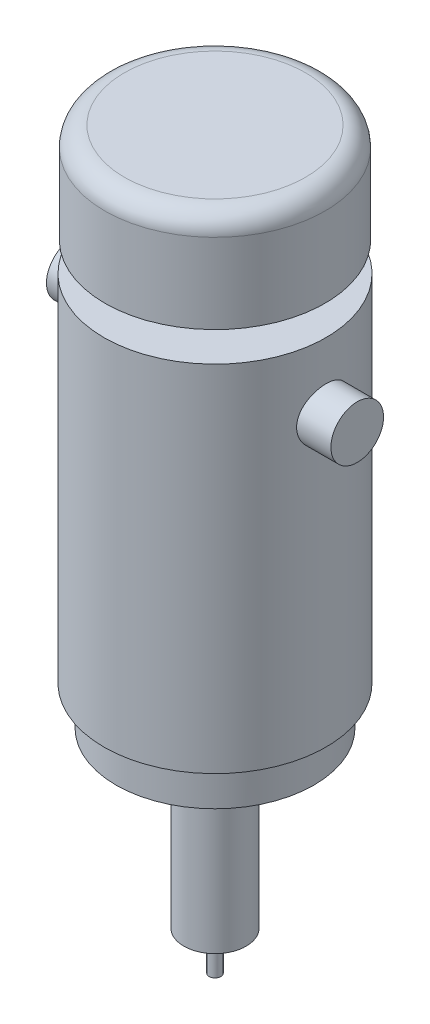
from build123d import *

# Parameters (mm, degrees)
SKETCH1_R           = 28.5
BOSS_EXTRUDE1_DEPTH = 45.5
SKETCH4_R           = 25.4
BOSS_EXTRUDE4_DEPTH = 10
SKETCH5_R           = 12.65
BOSS_EXTRUDE5_DEPTH = 2.5
SKETCH2_R           = 8
BOSS_EXTRUDE2_DEPTH = 42
SKETCH6_R           = 4
BOSS_EXTRUDE6_DEPTH = 33
SKETCH7_R           = 28.25
BOSS_EXTRUDE7_DEPTH = 25.5
FILLET1_R           = 5
SKETCH3_R           = 1.5
BOSS_EXTRUDE3_DEPTH = 10
SKETCH8_R           = 6.75
BOSS_EXTRUDE8_DEPTH = 36.5


with BuildPart() as part:
    # Sketch1 → Boss-Extrude1 (new, symmetric)
    with BuildSketch(Plane(origin=(0, 0, 0), x_dir=(1, 0, 0), z_dir=(0, 1, 0))):
        Circle(SKETCH1_R)
    extrude(amount=BOSS_EXTRUDE1_DEPTH, both=True)

    # Sketch4 → Boss-Extrude4 (add)
    with BuildSketch(Plane.XZ.offset(45.5)):
        Circle(SKETCH4_R)
    extrude(amount=BOSS_EXTRUDE4_DEPTH)

    # Sketch5 → Boss-Extrude5 (add)
    with BuildSketch(Plane.XZ.offset(55.5)):
        Circle(SKETCH5_R)
    extrude(amount=BOSS_EXTRUDE5_DEPTH)

    # Sketch2 → Boss-Extrude2 (add)
    with BuildSketch(Plane.XZ.offset(58)):
        Circle(SKETCH2_R)
    extrude(amount=BOSS_EXTRUDE2_DEPTH)

    # Sketch6 → Boss-Extrude6 (add)
    with BuildSketch(Plane(origin=(0, 45.5, 0), x_dir=(1, 0, 0), z_dir=(0, 1, 0))):
        Circle(SKETCH6_R)
    extrude(amount=BOSS_EXTRUDE6_DEPTH)

    # Sketch7 → Boss-Extrude7 (add)
    with BuildSketch(Plane(origin=(0, 78.5, 0), x_dir=(1, 0, 0), z_dir=(0, 1, 0))):
        Circle(SKETCH7_R)
    extrude(amount=-BOSS_EXTRUDE7_DEPTH)

    # Fillet1
    fillet1_edges = [part.edges().sort_by_distance(p)[0] for p in [
        (-28.25, 78.5, 0),
    ]]
    fillet(fillet1_edges, radius=FILLET1_R)

    # Sketch3 → Boss-Extrude3 (add)
    with BuildSketch(Plane.XZ.offset(100)):
        Circle(SKETCH3_R)
    extrude(amount=BOSS_EXTRUDE3_DEPTH)

    # Sketch8 → Boss-Extrude8 (add, symmetric)
    with BuildSketch(Plane(origin=(0, 0, 0), x_dir=(0, 0, -1), z_dir=(1, 0, 0))):
        with Locations((0, 28.5)):
            Circle(SKETCH8_R)
    extrude(amount=BOSS_EXTRUDE8_DEPTH, both=True)


solid = part.part
